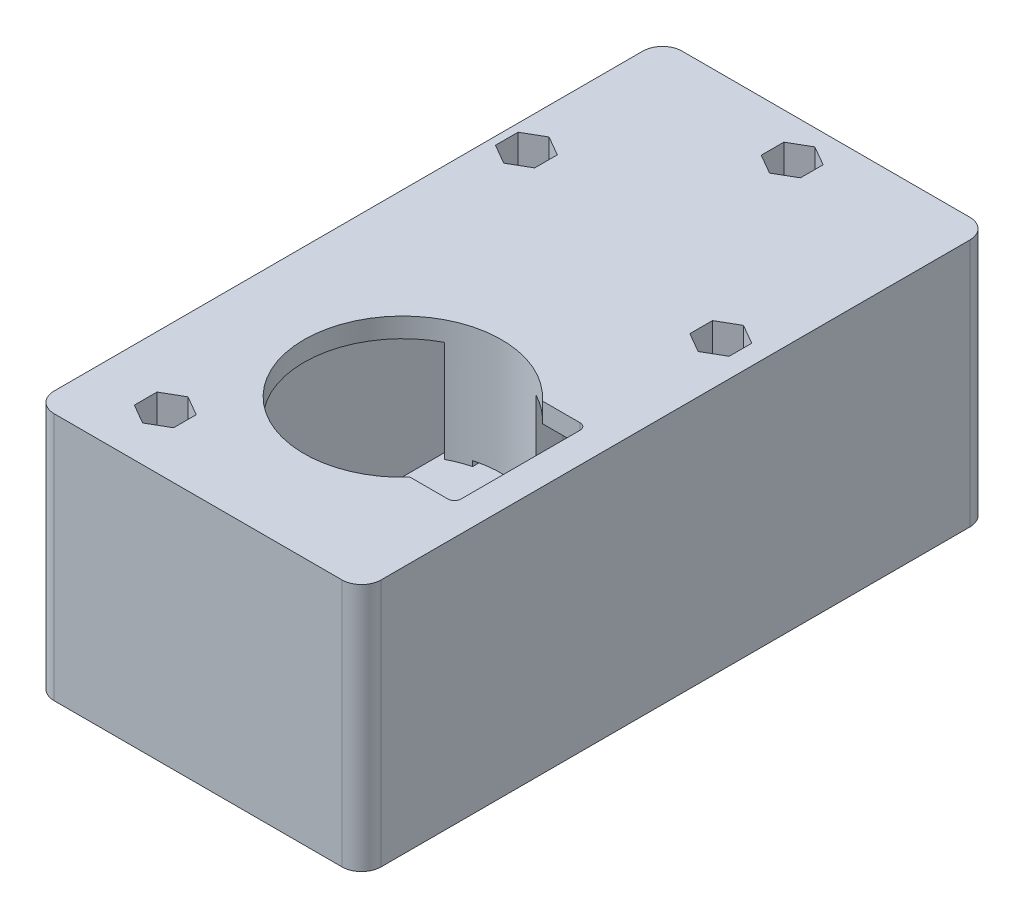
from build123d import *
from build123d.topology import SkipClean

# Parameters (mm, degrees)
SKETCH_1_W               = 50
SKETCH_1_H               = 38
EXTRUDE_1_DEPTH          = 3
SKETCH_2_W               = 50
SKETCH_2_H               = 38
SKETCH_2_W_2             = 44
SKETCH_2_H_2             = 32
EXTRUDE_2_DEPTH          = 90
SKETCH_4_R               = 7.3
CUT_EXTRUDE_1_DEPTH      = 45.2
SKETCH_5_R               = 10.3
SKETCH_5_R_2             = 7.3
EXTRUDE_3_DEPTH          = 16
SKETCH_6_R               = 8.3
SKETCH_6_R_2             = 5.8
EXTRUDE_5_DEPTH          = 1
SKETCH_7_R               = 4.3
EXTRUDE_6_DEPTH          = 2
SKETCH_8_R               = 6.3
SKETCH_8_R_2             = 4.3
EXTRUDE_7_DEPTH          = 10
SKETCH_9_W               = 2.635644668
SKETCH_9_H               = 4.5
CUT_EXTRUDE_2_DEPTH      = 4
SKETCH_10_R              = 0.7
SKETCH_10_W              = 2.7
SKETCH_10_H              = 2
EXTRUDE_8_DEPTH          = 32
SKETCH_11_W              = 14.06
SKETCH_11_H              = 9.36
EXTRUDE_9_DEPTH          = 4.4
SKETCH_12_W              = 14.06
SKETCH_12_H              = 9.36
EXTRUDE_10_DEPTH         = 21.2
CUT_EXTRUDE_3_DEPTH      = 3
SKETCH_14_R              = 1.65
EXTRUDE_11_DEPTH         = 15.5
EXTRUDE_12_DEPTH         = 15.5
CUT_EXTRUDE_4_DEPTH      = 0.8
EXTRUDE_13_DEPTH         = 18
SKETCH_18_W              = 19.83
SKETCH_18_H              = 32
SKETCH_18_R              = 6.3
EXTRUDE_14_DEPTH         = 10
SKETCH_19_W              = 4.445486426
SKETCH_19_H              = 4.5
CUT_EXTRUDE_5_DEPTH      = 4
EXTRUDE_16_REACH         = 110.743
SKETCH_23_R              = 1.65
CUT_EXTRUDE_7_DEPTH      = 109.742815855
CUT_EXTRUDE_7_DEPTH_BACK = 109.742815855
SKETCH_25_R              = 1.65
CUT_EXTRUDE_8_DEPTH      = 24.5
SKETCH_29_W              = 50
SKETCH_29_H              = 38
EXTRUDE_17_DEPTH         = 3
FILLET_1_R               = 3


with BuildPart() as part:
    # 草图1 → 凸台-拉伸1 (new body)
    with BuildSketch(Plane.XY):
        with Locations((25, 19)):
            Rectangle(SKETCH_1_W, SKETCH_1_H)
    extrude(amount=-EXTRUDE_1_DEPTH)

    # 草图2 → 凸台-拉伸2 (add)
    with BuildSketch(Plane.XY):
        with Locations((25, 19)):
            Rectangle(SKETCH_2_W, SKETCH_2_H)
        with Locations((25, 19)):
            Rectangle(SKETCH_2_W_2, SKETCH_2_H_2, mode=Mode.SUBTRACT)
    extrude(amount=EXTRUDE_2_DEPTH)

    # 草图4 → 切除-拉伸1 (cut)
    with BuildSketch(Plane(origin=(0, 0, -3), x_dir=(-1, 0, 0), z_dir=(0, 0, -1))):
        with Locations((-12.5, 10.5)):
            Circle(SKETCH_4_R)
    extrude(amount=-CUT_EXTRUDE_1_DEPTH, mode=Mode.SUBTRACT)

    # 草图5 → 凸台-拉伸3 (add)
    with BuildSketch(Plane.XY):
        with Locations((12.5, 10.5)):
            Circle(SKETCH_5_R)
        with Locations(Location((12.5, 10.5, 0), (0, 0, 180))):
            Circle(SKETCH_5_R_2, mode=Mode.SUBTRACT)
    extrude(amount=EXTRUDE_3_DEPTH)

    # 草图6 → 凸台-拉伸5 (add)
    with BuildSketch(Plane(origin=(0, 0, -3), x_dir=(-1, 0, 0), z_dir=(0, 0, -1))):
        with Locations((-12.5, 10.5)):
            Circle(SKETCH_6_R)
        with Locations((-12.5, 10.5)):
            Circle(SKETCH_6_R_2, mode=Mode.SUBTRACT)
    extrude(amount=-EXTRUDE_5_DEPTH)

    # 草图7 → 凸台-拉伸6 (add)
    with BuildSketch(Plane.XY.offset(16)):
        with BuildLine():
            Line((5.440254962, 3), (19.559745038, 3))
            ThreePointArc((19.559745038, 3), (18.368221419, 18.964867239), (3, 14.479949748))
            Line((3, 14.479949748), (3, 6.520050252))
            ThreePointArc((3, 6.520050252), (4.035132761, 4.631778581), (5.440254962, 3))
        make_face()
        with Locations((12.5, 10.5)):
            Circle(SKETCH_7_R, mode=Mode.SUBTRACT)
    extrude(amount=EXTRUDE_6_DEPTH)

    # 草图8 → 凸台-拉伸7 (add)
    with BuildSketch(Plane.XY.offset(18)):
        with Locations((12.5, 10.5)):
            Circle(SKETCH_8_R)
        with Locations((12.5, 10.5)):
            Circle(SKETCH_8_R_2, mode=Mode.SUBTRACT)
    extrude(amount=EXTRUDE_7_DEPTH)

    # 草图9 → 切除-拉伸2 (cut)
    with BuildSketch(Plane.XY.offset(28)):
        with Locations((17.482177666, 10.5)):
            Rectangle(SKETCH_9_W, SKETCH_9_H)
    extrude(amount=-CUT_EXTRUDE_2_DEPTH, mode=Mode.SUBTRACT)

    # 草图10 → 凸台-拉伸8 (add)
    with BuildSketch(Plane(origin=(0, 3, 0), x_dir=(1, 0, 0), z_dir=(0, 1, 0))):
        with Locations(Location((19.92, -32.88, 0), (0, 0, 180))):
            Circle(SKETCH_10_R)
        with Locations(Location((26.54, -32.88, 0), (0, 0, 180))):
            Circle(SKETCH_10_R)
        with Locations((20.68, -35.76)):
            Rectangle(SKETCH_10_W, SKETCH_10_H)
        with Locations((25.78, -35.76)):
            Rectangle(SKETCH_10_W, SKETCH_10_H)
    extrude(amount=EXTRUDE_8_DEPTH)

    # 草图11 → 凸台-拉伸9 (add)
    with BuildSketch(Plane(origin=(0, 3, 0), x_dir=(1, 0, 0), z_dir=(0, 1, 0))):
        with Locations((23.23, -32.08)):
            Rectangle(SKETCH_11_W, SKETCH_11_H)
    extrude(amount=EXTRUDE_9_DEPTH)

    # 草图12 → 凸台-拉伸10 (add)
    with BuildSketch(Plane.XZ.offset(-35)):
        with Locations((23.23, 32.08)):
            Rectangle(SKETCH_12_W, SKETCH_12_H)
    extrude(amount=EXTRUDE_10_DEPTH)

    # 草图13 → 切除-拉伸3 (cut)
    with BuildSketch(Plane(origin=(0, 38, 0), x_dir=(1, 0, 0), z_dir=(0, 1, 0))):
        with BuildLine():
            Line((38.62497216, -74.195968058), (44.4, -74.195968058))
            ThreePointArc((44.4, -74.195968058), (45.107106781, -73.903074839), (45.4, -73.195968058))
            Line((45.4, -73.195968058), (45.4, -54.995968058))
            ThreePointArc((45.4, -54.995968058), (45.107106781, -54.288861277), (44.4, -53.995968058))
            Line((44.4, -53.995968058), (38.62497216, -53.995968058))
            ThreePointArc((38.62497216, -53.995968058), (12.3, -64.095968058), (38.62497216, -74.195968058))
        make_face()
    extrude(amount=-CUT_EXTRUDE_3_DEPTH, mode=Mode.SUBTRACT)

    # 草图14 → 凸台-拉伸11 (add)
    # profile 1 of 2: a face of its own
    with SkipClean():  # the faces are left unmerged after this step: merging them gives an invalid solid
        with BuildSketch(Plane.XZ.offset(-35)):
            with BuildLine():
                Line((23.9, 46.595968058), (23.9, 49.407196837))
                ThreePointArc((23.9, 49.407196837), (27.4, 48.995968058), (30.9, 49.407196837))
                Line((30.9, 49.407196837), (30.9, 46.595968058))
                ThreePointArc((30.9, 46.595968058), (27.4, 43.095968058), (23.9, 46.595968058))
            make_face()
            with Locations((27.4, 46.595968058)):
                Circle(SKETCH_14_R, mode=Mode.SUBTRACT)
        # profile 2 of 2: a face of its own
        with BuildSketch(Plane.XZ.offset(-35)):
            with BuildLine():
                Line((30.9, 81.595968058), (30.9, 78.78473928))
                ThreePointArc((30.9, 78.78473928), (27.4, 79.195968058), (23.9, 78.78473928))
                Line((23.9, 78.78473928), (23.9, 81.595968058))
                ThreePointArc((23.9, 81.595968058), (27.4, 85.095968058), (30.9, 81.595968058))
            make_face()
            with Locations(Location((27.4, 81.595968058, 0), (0, 0, 90))):
                Circle(SKETCH_14_R, mode=Mode.SUBTRACT)
        extrude(amount=EXTRUDE_11_DEPTH)

    # 草图15 → 凸台-拉伸12 (add)
    with SkipClean():  # the faces are left unmerged after this step: merging them gives an invalid solid
        with BuildSketch(Plane.XZ.offset(-35)):
            with BuildLine():
                ThreePointArc((23.9, 49.407196837), (22.109340992, 49.953163271), (20.4, 50.716506186))
                Line((20.4, 50.716506186), (20.4, 46.595968058))
                ThreePointArc((20.4, 46.595968058), (27.4, 39.595968058), (34.4, 46.595968058))
                Line((34.4, 46.595968058), (34.4, 50.716506186))
                ThreePointArc((34.4, 50.716506186), (32.690659008, 49.953163271), (30.9, 49.407196837))
                Line((30.9, 49.407196837), (30.9, 46.595968058))
                ThreePointArc((30.9, 46.595968058), (27.4, 43.095968058), (23.9, 46.595968058))
                Line((23.9, 46.595968058), (23.9, 49.407196837))
            make_face()
            with BuildLine():
                Line((20.4, 81.595968058), (20.4, 77.475429931))
                ThreePointArc((20.4, 77.475429931), (22.109340992, 78.238772846), (23.9, 78.78473928))
                Line((23.9, 78.78473928), (23.9, 81.595968058))
                ThreePointArc((23.9, 81.595968058), (27.4, 85.095968058), (30.9, 81.595968058))
                Line((30.9, 81.595968058), (30.9, 78.78473928))
                ThreePointArc((30.9, 78.78473928), (32.690659008, 78.238772846), (34.4, 77.475429931))
                Line((34.4, 77.475429931), (34.4, 81.595968058))
                ThreePointArc((34.4, 81.595968058), (27.4, 88.595968058), (20.4, 81.595968058))
            make_face()
        extrude(amount=EXTRUDE_12_DEPTH)

    # 草图16 → 切除-拉伸4 (cut)
    with SkipClean():  # the faces are left unmerged after this step: merging them gives an invalid solid
        with BuildSketch(Plane.XZ.offset(-19.5)):
            with BuildLine():
                Line((31.3, 81.595968058), (31.3, 77.229132186))
                ThreePointArc((31.3, 77.229132186), (27.4, 77.795968058), (23.5, 77.229132186))
                Line((23.5, 77.229132186), (23.5, 81.595968058))
                ThreePointArc((23.5, 81.595968058), (27.4, 85.495968058), (31.3, 81.595968058))
            make_face()
            with BuildLine():
                Line((31.3, 46.595968058), (31.3, 50.962803931))
                ThreePointArc((31.3, 50.962803931), (27.4, 50.395968058), (23.5, 50.962803931))
                Line((23.5, 50.962803931), (23.5, 46.595968058))
                ThreePointArc((23.5, 46.595968058), (27.4, 42.695968058), (31.3, 46.595968058))
            make_face()
        extrude(amount=-CUT_EXTRUDE_4_DEPTH, mode=Mode.SUBTRACT)

    # 草图17 → 凸台-拉伸13 (add)
    with SkipClean():  # the faces are left unmerged after this step: merging them gives an invalid solid
        with BuildSketch(Plane.XY):
            with BuildLine():
                Line((22.83, 3), (22.83, 10.539153682))
                Line((22.83, 10.539153682), (22.83, 35))
                Line((22.83, 35), (3, 35))
                Line((3, 35), (3, 14.479949748))
                ThreePointArc((3, 14.479949748), (18.368221419, 18.964867239), (19.559745038, 3))
                Line((19.559745038, 3), (22.83, 3))
            make_face()
            with BuildLine():
                Line((5.440254962, 3), (3, 3))
                Line((3, 3), (3, 6.520050252))
                ThreePointArc((3, 6.520050252), (4.035132761, 4.631778581), (5.440254962, 3))
            make_face()
        extrude(amount=EXTRUDE_13_DEPTH)

    # 草图18 → 凸台-拉伸14 (add)
    with SkipClean():  # the faces are left unmerged after this step: merging them gives an invalid solid
        with BuildSketch(Plane.XY.offset(18)):
            with Locations((12.915, 19)):
                Rectangle(SKETCH_18_W, SKETCH_18_H)
            with Locations((12.5, 10.5)):
                Circle(SKETCH_18_R, mode=Mode.SUBTRACT)
        extrude(amount=EXTRUDE_14_DEPTH)

    # 草图19 → 切除-拉伸5 (cut)
    with SkipClean():  # the faces are left unmerged after this step: merging them gives an invalid solid
        with BuildSketch(Plane.XY.offset(28)):
            with Locations((20.607256787, 10.5)):
                Rectangle(SKETCH_19_W, SKETCH_19_H)
        extrude(amount=-CUT_EXTRUDE_5_DEPTH, mode=Mode.SUBTRACT)

    # 草图23 → 凸台-拉伸16 (add, up to next)
    with BuildSketch(Plane.XZ.offset(-35), mode=Mode.PRIVATE) as extrude_16_sk1:
        with BuildLine():
            Line((22.83, 0), (22.83, 9))
            ThreePointArc((22.83, 9), (29.193961031, 6.363961031), (31.83, 0))
            Line((31.83, 0), (22.83, 0))
        make_face()
        with Locations(Location((25.83, 3, 0), (0, 0, 180))):
            Circle(SKETCH_23_R, mode=Mode.SUBTRACT)
    extrude_16_tool1 = extrude(extrude_16_sk1.sketch, amount=EXTRUDE_16_REACH, mode=Mode.PRIVATE) - part.part
    # 草图23 → 凸台-拉伸16 (add, up to next)
    with BuildSketch(Plane.XZ.offset(-35), mode=Mode.PRIVATE) as extrude_16_sk2:
        with BuildLine():
            Line((44, 26.08), (47, 26.08))
            Line((47, 26.08), (47, 38.08))
            Line((47, 38.08), (44, 38.08))
            ThreePointArc((44, 38.08), (38, 32.08), (44, 26.08))
        make_face()
        with Locations(Location((44, 32.08, 0), (0, 0, 180))):
            Circle(SKETCH_23_R, mode=Mode.SUBTRACT)
    extrude_16_tool2 = extrude(extrude_16_sk2.sketch, amount=EXTRUDE_16_REACH, mode=Mode.PRIVATE) - part.part
    # 草图23 → 凸台-拉伸16 (add, up to next)
    with BuildSketch(Plane.XZ.offset(-35), mode=Mode.PRIVATE) as extrude_16_sk3:
        with BuildLine():
            Line((5, 90), (5, 84))
            ThreePointArc((5, 84), (11, 78), (17, 84))
            Line((17, 84), (17, 90))
            Line((17, 90), (5, 90))
        make_face()
        with Locations(Location((11, 84, 0), (0, 0, 180))):
            Circle(SKETCH_23_R, mode=Mode.SUBTRACT)
    extrude_16_tool3 = extrude(extrude_16_sk3.sketch, amount=EXTRUDE_16_REACH, mode=Mode.PRIVATE) - part.part
    add(extrude_16_tool1.solids().sort_by_distance((27.33, 35, 0.127279))[0])
    add(extrude_16_tool2.solids().sort_by_distance((45.5, 35, 26.23))[0])
    add(extrude_16_tool3.solids().sort_by_distance((11, 35, 78.169706))[0])

    # 草图25 → 切除-拉伸7 (cut, two sides: drawn at the far end of the back side and taken through both)
    with BuildSketch(Plane.XZ.offset(-35).offset(-CUT_EXTRUDE_7_DEPTH_BACK)):
        with Locations((4.2, 22)):
            Circle(SKETCH_25_R)
        with Locations((25.83, 3)):
            Circle(SKETCH_25_R)
        with Locations((44, 32.08)):
            Circle(SKETCH_25_R)
        with Locations((11, 84)):
            Circle(SKETCH_25_R)
    extrude(amount=CUT_EXTRUDE_7_DEPTH + CUT_EXTRUDE_7_DEPTH_BACK, mode=Mode.SUBTRACT)

    # 草图26 → 切除-拉伸8 (cut)
    with SkipClean():  # the faces are left unmerged after this step: merging them gives an invalid solid
        with BuildSketch(Plane(origin=(0, 38, 0), x_dir=(1, 0, 0), z_dir=(0, 1, 0))):
            Polygon((4.2, -18.537081721), (1.201024799, -20.268540861), (1.201024799, -23.731459139), (4.2, -25.462918279), (7.198975201, -23.731459139), (7.198975201, -20.268540861), align=None)
            Polygon((25.83, -6.462918279), (28.828975201, -4.731459139), (28.828975201, -1.268540861), (25.83, 0.462918279), (22.831024799, -1.268540861), (22.831024799, -4.731459139), align=None)
            Polygon((11, -80.537081721), (8.001024799, -82.268540861), (8.001024799, -85.731459139), (11, -87.462918279), (13.998975201, -85.731459139), (13.998975201, -82.268540861), align=None)
            Polygon((44, -28.617081721), (41.001024799, -30.348540861), (41.001024799, -33.811459139), (44, -35.542918279), (46.998975201, -33.811459139), (46.998975201, -30.348540861), align=None)
        extrude(amount=-CUT_EXTRUDE_8_DEPTH, mode=Mode.SUBTRACT)

    # 草图29 → 凸台-拉伸17 (add)
    with SkipClean():  # the faces are left unmerged after this step: merging them gives an invalid solid
        with BuildSketch(Plane.XY.offset(90)):
            with Locations((25, 19)):
                Rectangle(SKETCH_29_W, SKETCH_29_H)
        extrude(amount=EXTRUDE_17_DEPTH)

    # 圆角1
    fillet_1_edges = [part.edges().sort_by_distance(p)[0] for p in [
        (0, 19, -3),
        (50, 19, -3),
        (0, 19, 93),
        (50, 19, 93),
    ]]
    fillet(fillet_1_edges, radius=FILLET_1_R - 0.0001)  # a hair under: the kernel refuses the full size


solid = part.part
